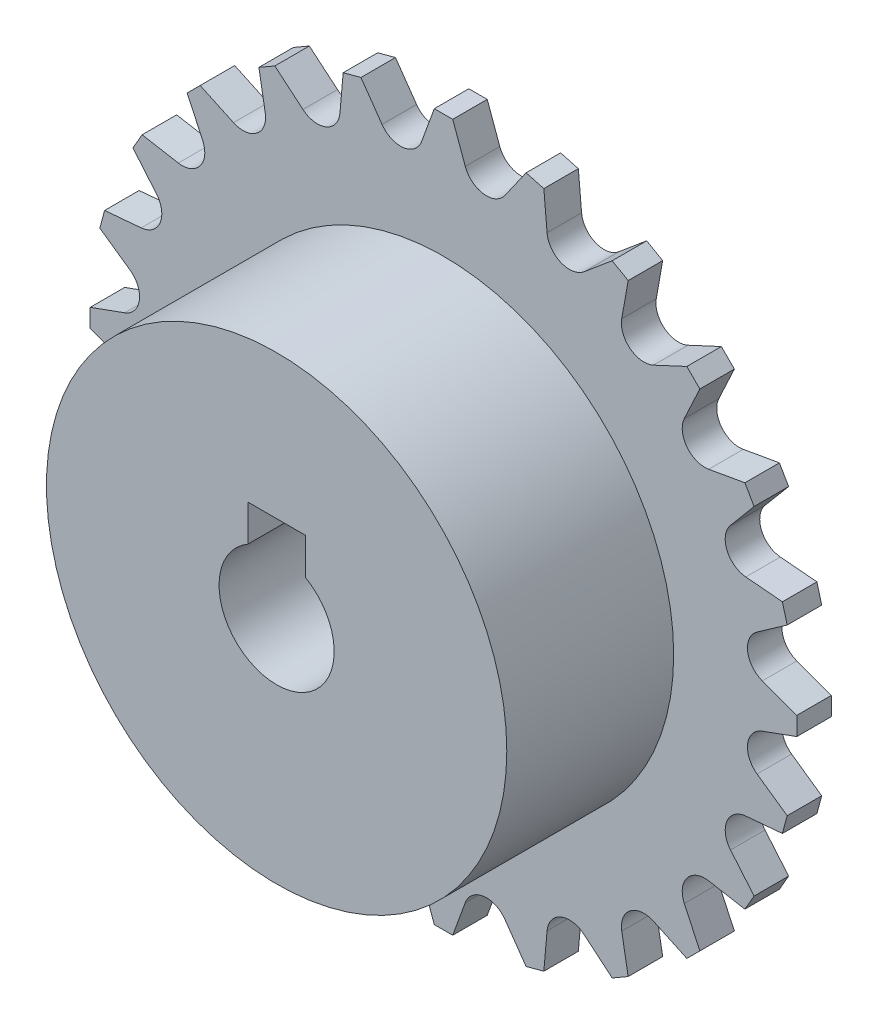
from build123d import *

# Parameters (mm, degrees)
SKETCH1_R           = 25.4
BOSS_EXTRUDE1_DEPTH = 3.81
SKETCH1_3_R         = 25.4
BOSS_EXTRUDE2_DEPTH = 22.225


with BuildPart() as part:
    # Sketch1 → Boss-Extrude1 (new body)
    with BuildSketch(Plane.XY):
        with BuildLine():
            Line((1.016, 38.989), (-1.016, 38.989))
            Line((-1.016, 38.989), (-2.402726593, 35.179))
            ThreePointArc((-2.402726593, 35.179), (-4.418420371, 33.561234708), (-6.784139518, 34.602176045))
            Line((-6.784139518, 34.602176045), (-9.10971511, 37.923442191))
            Line((-9.10971511, 37.923442191), (-11.072476389, 37.397521891))
            Line((-11.072476389, 37.397521891), (-11.425850857, 33.358433241))
            ThreePointArc((-11.425850857, 33.358433241), (-12.954153068, 31.274092025), (-15.508677732, 31.667270976))
            Line((-15.508677732, 31.667270976), (-18.61461819, 34.273464468))
            Line((-18.61461819, 34.273464468), (-20.37438181, 33.257464468))
            Line((-20.37438181, 33.257464468), (-19.670322267, 29.264544383))
            ThreePointArc((-19.670322268, 29.264544383), (-20.60708164, 26.855671653), (-23.176325188, 26.574293722))
            Line((-23.176325188, 26.574293722), (-26.850965802, 28.287806781))
            Line((-26.850965802, 28.287806781), (-28.287806781, 26.850965802))
            Line((-28.287806781, 26.850965802), (-26.574293722, 23.176325188))
            ThreePointArc((-26.574293722, 23.176325188), (-26.855671653, 20.60708164), (-29.264544383, 19.670322268))
            Line((-29.264544383, 19.670322268), (-33.257464468, 20.37438181))
            Line((-33.257464468, 20.37438181), (-34.273464468, 18.61461819))
            Line((-34.273464468, 18.61461819), (-31.667270976, 15.508677732))
            ThreePointArc((-31.667270976, 15.508677732), (-31.274092025, 12.954153068), (-33.358433241, 11.425850857))
            Line((-33.358433241, 11.425850857), (-37.397521891, 11.072476389))
            Line((-37.397521891, 11.072476389), (-37.923442191, 9.10971511))
            Line((-37.923442191, 9.10971511), (-34.602176045, 6.784139518))
            ThreePointArc((-34.602176045, 6.784139518), (-33.561234708, 4.418420371), (-35.179, 2.402726593))
            Line((-35.179, 2.402726593), (-38.989, 1.016))
            Line((-38.989, 1.016), (-38.989, -1.016))
            Line((-38.989, -1.016), (-35.179, -2.402726593))
            ThreePointArc((-35.179, -2.402726593), (-33.561234708, -4.418420371), (-34.602176045, -6.784139518))
            Line((-34.602176045, -6.784139518), (-37.923442191, -9.10971511))
            Line((-37.923442191, -9.10971511), (-37.397521891, -11.072476389))
            Line((-37.397521891, -11.072476389), (-33.358433241, -11.425850857))
            ThreePointArc((-33.358433241, -11.425850857), (-31.274092025, -12.954153068), (-31.667270976, -15.508677732))
            Line((-31.667270976, -15.508677732), (-34.273464468, -18.61461819))
            Line((-34.273464468, -18.61461819), (-33.257464468, -20.37438181))
            Line((-33.257464468, -20.37438181), (-29.264544383, -19.670322268))
            ThreePointArc((-29.264544383, -19.670322268), (-26.855671653, -20.60708164), (-26.574293722, -23.176325188))
            Line((-26.574293722, -23.176325188), (-28.287806781, -26.850965802))
            Line((-28.287806781, -26.850965802), (-26.850965802, -28.287806781))
            Line((-26.850965802, -28.287806781), (-23.176325188, -26.574293722))
            ThreePointArc((-23.176325188, -26.574293722), (-20.60708164, -26.855671653), (-19.670322268, -29.264544383))
            Line((-19.670322268, -29.264544383), (-20.37438181, -33.257464468))
            Line((-20.37438181, -33.257464468), (-18.61461819, -34.273464468))
            Line((-18.61461819, -34.273464468), (-15.508677732, -31.667270976))
            ThreePointArc((-15.508677732, -31.667270976), (-12.954153068, -31.274092025), (-11.425850857, -33.358433241))
            Line((-11.425850857, -33.358433241), (-11.072476389, -37.397521891))
            Line((-11.072476389, -37.397521891), (-9.10971511, -37.923442191))
            Line((-9.10971511, -37.923442191), (-6.784139518, -34.602176045))
            ThreePointArc((-6.784139518, -34.602176045), (-4.418420371, -33.561234708), (-2.402726593, -35.179))
            Line((-2.402726593, -35.179), (-1.016, -38.989))
            Line((-1.016, -38.989), (1.016, -38.989))
            Line((1.016, -38.989), (2.402726593, -35.179))
            ThreePointArc((2.402726593, -35.179), (4.418420371, -33.561234708), (6.784139518, -34.602176045))
            Line((6.784139518, -34.602176045), (9.10971511, -37.923442191))
            Line((9.10971511, -37.923442191), (11.072476389, -37.397521891))
            Line((11.072476389, -37.397521891), (11.425850857, -33.358433241))
            ThreePointArc((11.425850857, -33.358433241), (12.954153068, -31.274092025), (15.508677732, -31.667270976))
            Line((15.508677732, -31.667270976), (18.61461819, -34.273464468))
            Line((18.61461819, -34.273464468), (20.37438181, -33.257464468))
            Line((20.37438181, -33.257464468), (19.670322268, -29.264544383))
            ThreePointArc((19.670322268, -29.264544383), (20.60708164, -26.855671653), (23.176325188, -26.574293722))
            Line((23.176325188, -26.574293722), (26.850965802, -28.287806781))
            Line((26.850965802, -28.287806781), (28.287806781, -26.850965802))
            Line((28.287806781, -26.850965802), (26.574293722, -23.176325188))
            ThreePointArc((26.574293722, -23.176325188), (26.855671653, -20.60708164), (29.264544383, -19.670322268))
            Line((29.264544383, -19.670322268), (33.257464468, -20.37438181))
            Line((33.257464468, -20.37438181), (34.273464468, -18.61461819))
            Line((34.273464468, -18.61461819), (31.667270976, -15.508677732))
            ThreePointArc((31.667270976, -15.508677732), (31.274092025, -12.954153068), (33.358433241, -11.425850857))
            Line((33.358433241, -11.425850857), (37.397521891, -11.072476389))
            Line((37.397521891, -11.072476389), (37.923442191, -9.10971511))
            Line((37.923442191, -9.10971511), (34.602176045, -6.784139518))
            ThreePointArc((34.602176045, -6.784139518), (33.561234708, -4.418420371), (35.179, -2.402726593))
            Line((35.179, -2.402726593), (38.989, -1.016))
            Line((38.989, -1.016), (38.989, 1.016))
            Line((38.989, 1.016), (35.179, 2.402726593))
            ThreePointArc((35.179, 2.402726593), (33.561234708, 4.418420371), (34.602176045, 6.784139518))
            Line((34.602176045, 6.784139518), (37.923442191, 9.10971511))
            Line((37.923442191, 9.10971511), (37.397521891, 11.072476389))
            Line((37.397521891, 11.072476389), (33.358433241, 11.425850857))
            ThreePointArc((33.358433241, 11.425850857), (31.274092025, 12.954153068), (31.667270976, 15.508677732))
            Line((31.667270976, 15.508677732), (34.273464468, 18.61461819))
            Line((34.273464468, 18.61461819), (33.257464468, 20.37438181))
            Line((33.257464468, 20.37438181), (29.264544383, 19.670322268))
            ThreePointArc((29.264544383, 19.670322268), (26.855671653, 20.60708164), (26.574293722, 23.176325188))
            Line((26.574293722, 23.176325188), (28.287806781, 26.850965802))
            Line((28.287806781, 26.850965802), (26.850965802, 28.287806781))
            Line((26.850965802, 28.287806781), (23.176325188, 26.574293722))
            ThreePointArc((23.176325188, 26.574293722), (20.60708164, 26.855671653), (19.670322268, 29.264544383))
            Line((19.670322268, 29.264544383), (20.37438181, 33.257464468))
            Line((20.37438181, 33.257464468), (18.61461819, 34.273464468))
            Line((18.61461819, 34.273464468), (15.508677732, 31.667270976))
            ThreePointArc((15.508677732, 31.667270976), (12.954153068, 31.274092025), (11.425850857, 33.358433241))
            Line((11.425850857, 33.358433241), (11.072476389, 37.397521891))
            Line((11.072476389, 37.397521891), (9.10971511, 37.923442191))
            Line((9.10971511, 37.923442191), (6.784139518, 34.602176045))
            ThreePointArc((6.784139518, 34.602176045), (4.418420371, 33.561234708), (2.402726593, 35.179))
            Line((2.402726593, 35.179), (1.016, 38.989))
        make_face()
        Circle(SKETCH1_R, mode=Mode.SUBTRACT)
    extrude(amount=BOSS_EXTRUDE1_DEPTH)

    # Sketch1<3> → Boss-Extrude2 (add)
    with BuildSketch(Plane.XY):
        Circle(SKETCH1_3_R)
        with BuildLine():
            ThreePointArc((3.175, 5.499261314), (0, -6.35), (-3.175, 5.499261314))
            Line((-3.175, 5.499261314), (-3.175, 9.525))
            Line((-3.175, 9.525), (3.175, 9.525))
            Line((3.175, 9.525), (3.175, 5.499261314))
        make_face(mode=Mode.SUBTRACT)
    extrude(amount=BOSS_EXTRUDE2_DEPTH)


solid = part.part
